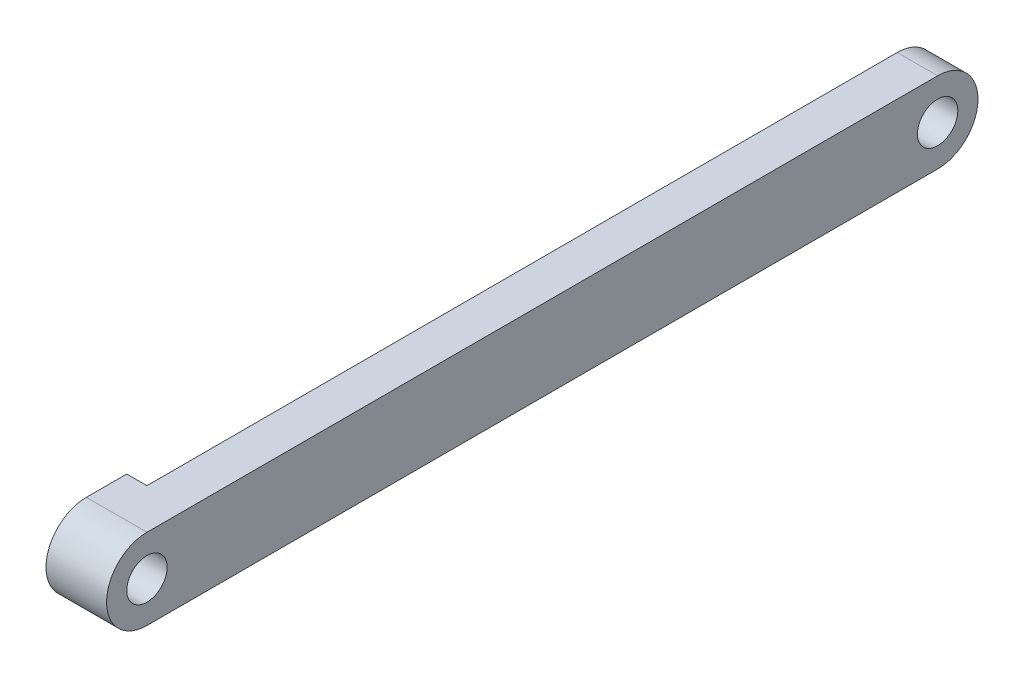
from build123d import *

# Parameters (mm, degrees)
SKETCH1_R           = 1
BOSS_EXTRUDE1_DEPTH = 3
SKETCH2_W           = 39.164
SKETCH2_H           = 4
CUT_EXTRUDE1_DEPTH  = 1


with BuildPart() as part:
    # Sketch1 → Boss-Extrude1 (new body)
    with BuildSketch(Plane(origin=(0, 0, 0), x_dir=(0, 0, -1), z_dir=(1, 0, 0))):
        with BuildLine():
            Line((0, -2), (39.164, -2))
            ThreePointArc((39.164, -2), (41.164, 0), (39.164, 2))
            Line((39.164, 2), (0, 2))
            ThreePointArc((0, 2), (-2, 0), (0, -2))
        make_face()
        Circle(SKETCH1_R, mode=Mode.SUBTRACT)
        with Locations((39.164, 0)):
            Circle(SKETCH1_R, mode=Mode.SUBTRACT)
    extrude(amount=BOSS_EXTRUDE1_DEPTH)

    # Sketch2 → Cut-Extrude1 (cut)
    with BuildSketch(Plane.ZY):
        with Locations((-21.582, 0)):
            Rectangle(SKETCH2_W, SKETCH2_H)
    extrude(amount=-CUT_EXTRUDE1_DEPTH, mode=Mode.SUBTRACT)


solid = part.part
